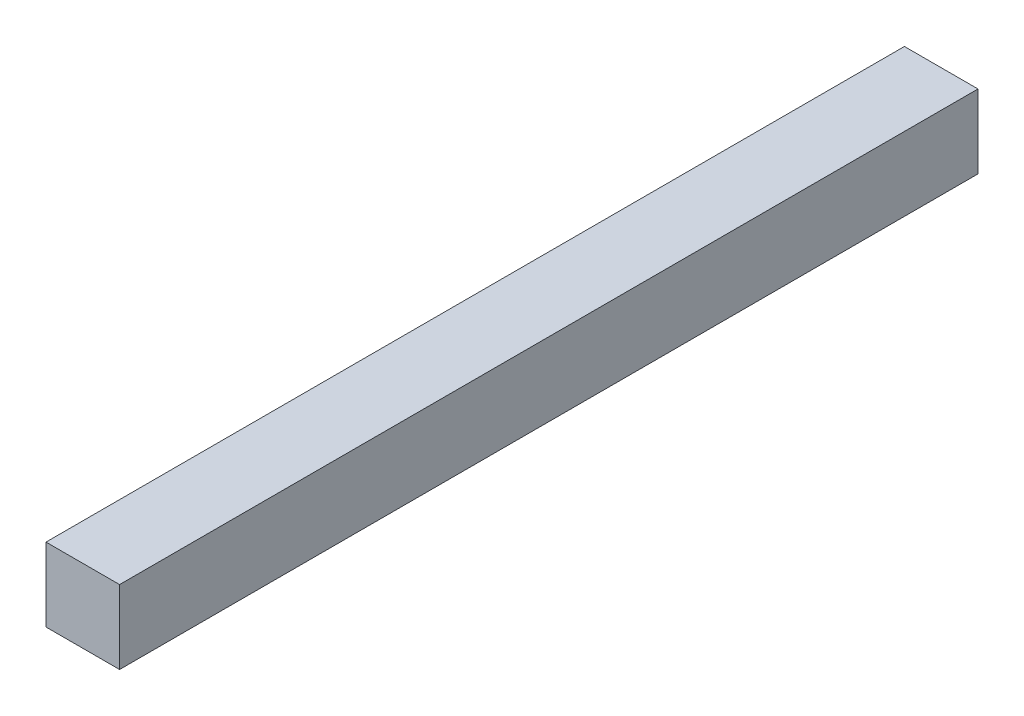
from build123d import *

# Parameters (mm, degrees)
SKETCH1_W           = 30
SKETCH1_H           = 30
BOSS_EXTRUDE1_DEPTH = 175


with BuildPart() as part:
    # Sketch1 → Boss-Extrude1 (new, symmetric)
    with BuildSketch(Plane.XY):
        Rectangle(SKETCH1_W, SKETCH1_H)
    extrude(amount=BOSS_EXTRUDE1_DEPTH, both=True)


solid = part.part
